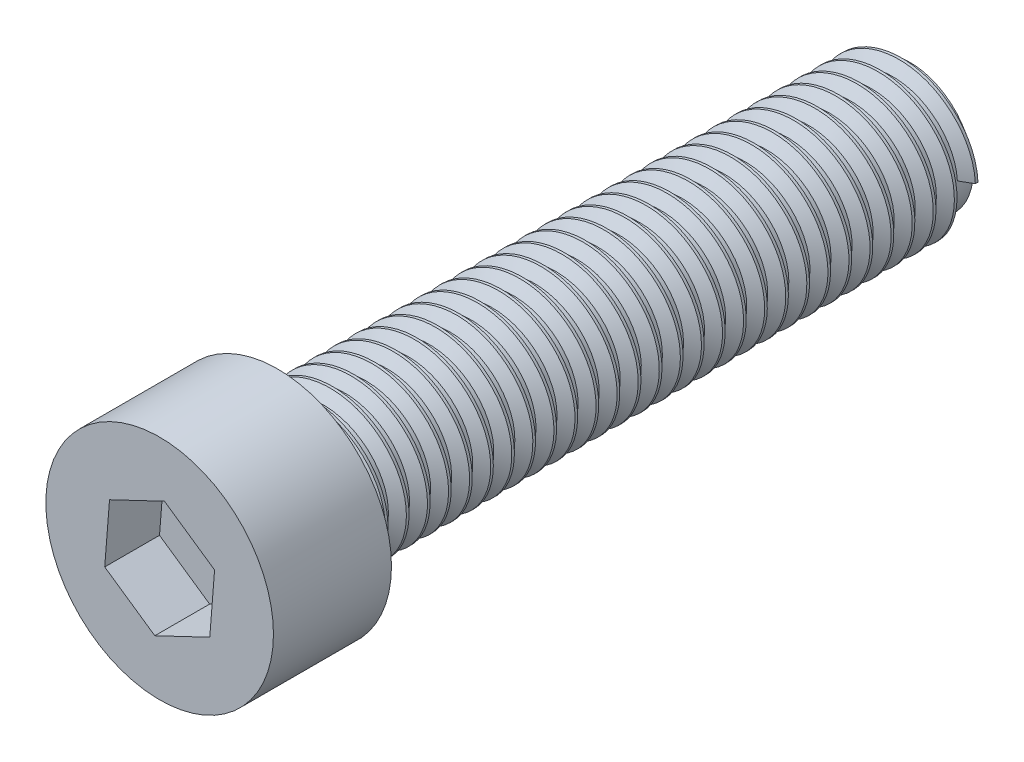
from build123d import *

# Parameters (mm, degrees)
SKETCH1_R           = 2.7
BOSS_EXTRUDE1_DEPTH = 2.8
CUT_EXTRUDE1_DEPTH  = 1.3
SKETCH3_R           = 1.5
BOSS_EXTRUDE2_DEPTH = 15
THREAD1_PITCH       = 0.5


with BuildPart() as part:
    # Sketch1 → Boss-Extrude1 (new body)
    with BuildSketch(Plane.XY):
        Circle(SKETCH1_R)
    extrude(amount=BOSS_EXTRUDE1_DEPTH)

    # Sketch2 → Cut-Extrude1 (cut)
    with BuildSketch(Plane.XY.offset(2.8)):
        Polygon((1.188918816, -0.818416387), (1.30322879, 0.620425704), (0.114309975, 1.438842091), (-1.188918816, 0.818416387), (-1.30322879, -0.620425704), (-0.114309975, -1.438842091), align=None)
    extrude(amount=-CUT_EXTRUDE1_DEPTH, mode=Mode.SUBTRACT)

    # Sketch3 → Boss-Extrude2 (add)
    with BuildSketch(Plane(origin=(0, 0, 0), x_dir=(-1, 0, 0), z_dir=(0, 0, -1))):
        Circle(SKETCH3_R)
    extrude(amount=BOSS_EXTRUDE2_DEPTH)

    # Thread1: the profile of Thread Profile1 profile screwed along a right-hand helix of 30 turns, 6 arcs to a turn; built about Z, then put on its axis
    thread1_z = Axis((0, 0, 0), (0, 0, 1))
    thread1_corners = [(1.4997, 0, -0.000173205), (1.770632938, 0, 0.156249999), (1.770632938, 0, 0.218749999), (1.4997, 0, 0.375173204)]
    with BuildLine(mode=Mode.PRIVATE) as thread1_profile:
        Line(thread1_corners[0], thread1_corners[1])
        Line(thread1_corners[1], thread1_corners[2])
        Line(thread1_corners[2], thread1_corners[3])
        Line(thread1_corners[3], thread1_corners[0])
    thread1_cap = Face(thread1_profile.wire())
    thread1_turn_angles = [0, 30, 60, 90, 120, 150, 180, 210, 240, 270, 300, 330, 360]
    thread1_turn_weights = [1, 0.8660254037844387, 1, 0.8660254037844387, 1, 0.8660254037844387, 1, 0.8660254037844387, 1, 0.8660254037844387, 1, 0.8660254037844387, 1]
    thread1_turn_rails = [Edge.make_bspline([Vector(p[0], p[1], 0).rotate(thread1_z, thread1_turn_angles[k]) / thread1_turn_weights[k] + Vector(0, 0, p[2] + THREAD1_PITCH * thread1_turn_angles[k] / 360) for k in range(13)], [0, 0, 0, 1, 1, 2, 2, 3, 3, 4, 4, 5, 5, 6, 6, 6], 2, thread1_turn_weights) for p in thread1_corners]
    thread1_turn_sides = [Face.make_surface_from_curves(thread1_turn_rails[p[0]], thread1_turn_rails[p[1]]) for p in [(0, 1), (1, 2), (2, 3), (3, 0)]]
    thread1 = Plane(origin=(0, 0, -15), x_dir=(1, 0, 0), z_dir=(0, 0, 1)) * Solid(Shell([*[p.moved(Location((0, 0, THREAD1_PITCH * i))) for i in range(30) for p in thread1_turn_sides], thread1_cap, thread1_cap.rotate(thread1_z, 10800).moved(Location((0, 0, THREAD1_PITCH * 10800 / 360)))]))
    add(thread1)


solid = part.part
